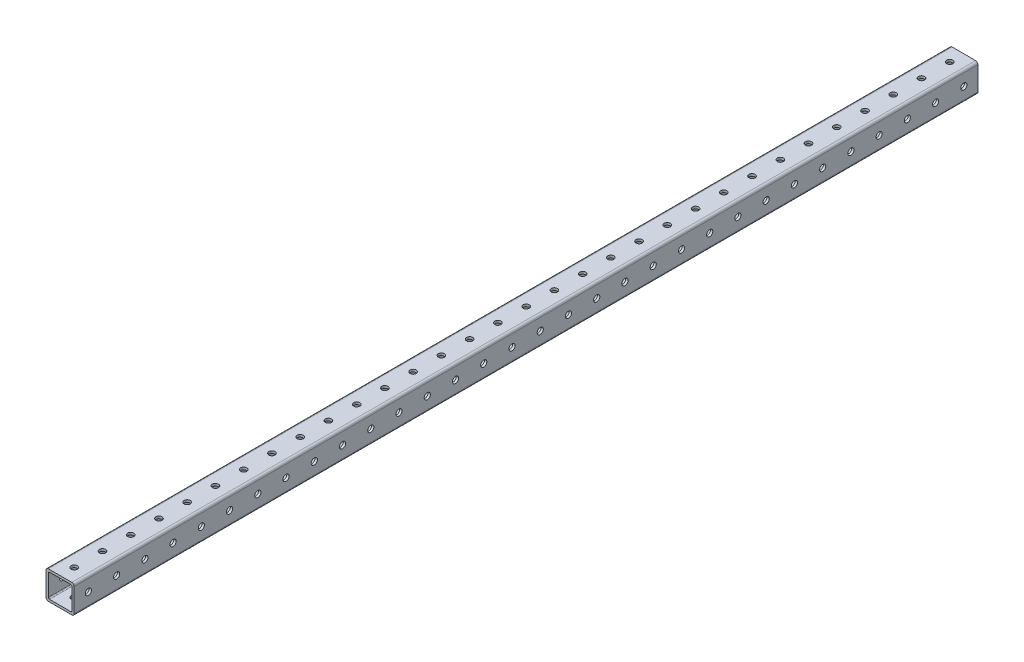
from build123d import *

# Parameters (mm, degrees)
SKETCH1_W                    = 31.75
SKETCH1_H                    = 31.75
EXTRUDE_THIN1_DEPTH          = 609.6
FILLET1_R                    = 1.6002
SKETCH2_R                    = 4.1656
CUT_EXTRUDE1_DEPTH           = 611.195022104
LPATTERN1_COUNT              = 32
LPATTERN1_PITCH              = 38.1
CIRPATTERN1_COPY_1_SKETCH_R  = 4.1656
CIRPATTERN1_COPY_1_DEPTH     = 611.195022104
CIRPATTERN1_COPY_2_SKETCH_R  = 4.1656
CIRPATTERN1_COPY_2_DEPTH     = 611.195022104
CIRPATTERN1_COPY_3_SKETCH_R  = 4.1656
CIRPATTERN1_COPY_3_DEPTH     = 611.195022104
CIRPATTERN1_COPY_4_SKETCH_R  = 4.1656
CIRPATTERN1_COPY_4_DEPTH     = 611.195022104
CIRPATTERN1_COPY_5_SKETCH_R  = 4.1656
CIRPATTERN1_COPY_5_DEPTH     = 611.195022104
CIRPATTERN1_COPY_6_SKETCH_R  = 4.1656
CIRPATTERN1_COPY_6_DEPTH     = 611.195022104
CIRPATTERN1_COPY_7_SKETCH_R  = 4.1656
CIRPATTERN1_COPY_7_DEPTH     = 611.195022104
CIRPATTERN1_COPY_8_SKETCH_R  = 4.1656
CIRPATTERN1_COPY_8_DEPTH     = 611.195022104
CIRPATTERN1_COPY_9_SKETCH_R  = 4.1656
CIRPATTERN1_COPY_9_DEPTH     = 611.195022104
CIRPATTERN1_COPY_10_SKETCH_R = 4.1656
CIRPATTERN1_COPY_10_DEPTH    = 611.195022104
CIRPATTERN1_COPY_11_SKETCH_R = 4.1656
CIRPATTERN1_COPY_11_DEPTH    = 611.195022104
CIRPATTERN1_COPY_12_SKETCH_R = 4.1656
CIRPATTERN1_COPY_12_DEPTH    = 611.195022104
CIRPATTERN1_COPY_13_SKETCH_R = 4.1656
CIRPATTERN1_COPY_13_DEPTH    = 611.195022104
CIRPATTERN1_COPY_14_SKETCH_R = 4.1656
CIRPATTERN1_COPY_14_DEPTH    = 611.195022104
CIRPATTERN1_COPY_15_SKETCH_R = 4.1656
CIRPATTERN1_COPY_15_DEPTH    = 611.195022104
CIRPATTERN1_COPY_16_SKETCH_R = 4.1656
CIRPATTERN1_COPY_16_DEPTH    = 611.195022104
CIRPATTERN1_COPY_17_SKETCH_R = 4.1656
CIRPATTERN1_COPY_17_DEPTH    = 611.195022104
CIRPATTERN1_COPY_18_SKETCH_R = 4.1656
CIRPATTERN1_COPY_18_DEPTH    = 611.195022104
CIRPATTERN1_COPY_19_SKETCH_R = 4.1656
CIRPATTERN1_COPY_19_DEPTH    = 611.195022104
CIRPATTERN1_COPY_20_SKETCH_R = 4.1656
CIRPATTERN1_COPY_20_DEPTH    = 611.195022104
CIRPATTERN1_COPY_21_SKETCH_R = 4.1656
CIRPATTERN1_COPY_21_DEPTH    = 611.195022104
CIRPATTERN1_COPY_22_SKETCH_R = 4.1656
CIRPATTERN1_COPY_22_DEPTH    = 611.195022104
CIRPATTERN1_COPY_23_SKETCH_R = 4.1656
CIRPATTERN1_COPY_23_DEPTH    = 611.195022104
CIRPATTERN1_COPY_24_SKETCH_R = 4.1656
CIRPATTERN1_COPY_24_DEPTH    = 611.195022104
CIRPATTERN1_COPY_25_SKETCH_R = 4.1656
CIRPATTERN1_COPY_25_DEPTH    = 611.195022104
CIRPATTERN1_COPY_26_SKETCH_R = 4.1656
CIRPATTERN1_COPY_26_DEPTH    = 611.195022104
CIRPATTERN1_COPY_27_SKETCH_R = 4.1656
CIRPATTERN1_COPY_27_DEPTH    = 611.195022104
CIRPATTERN1_COPY_28_SKETCH_R = 4.1656
CIRPATTERN1_COPY_28_DEPTH    = 611.195022104
CIRPATTERN1_COPY_29_SKETCH_R = 4.1656
CIRPATTERN1_COPY_29_DEPTH    = 611.195022104
CIRPATTERN1_COPY_30_SKETCH_R = 4.1656
CIRPATTERN1_COPY_30_DEPTH    = 611.195022104
CIRPATTERN1_COPY_31_SKETCH_R = 4.1656
CIRPATTERN1_COPY_31_DEPTH    = 611.195022104
CIRPATTERN1_COPY_32_SKETCH_R = 4.1656
CIRPATTERN1_COPY_32_DEPTH    = 611.195022104


with BuildPart() as part:
    # Sketch1 → Extrude-Thin1 (new, symmetric)
    with BuildSketch(Plane.XY):
        with BuildLine():
            Line((-15.875, 19.05), (15.875, 19.05))
            ThreePointArc((15.875, 19.05), (18.12006403, 18.12006403), (19.05, 15.875))
            Line((19.05, 15.875), (19.05, -15.875))
            ThreePointArc((19.05, -15.875), (18.12006403, -18.12006403), (15.875, -19.05))
            Line((15.875, -19.05), (-15.875, -19.05))
            ThreePointArc((-15.875, -19.05), (-18.12006403, -18.12006403), (-19.05, -15.875))
            Line((-19.05, -15.875), (-19.05, 15.875))
            ThreePointArc((-19.05, 15.875), (-18.12006403, 18.12006403), (-15.875, 19.05))
        make_face()
        Rectangle(SKETCH1_W, SKETCH1_H, mode=Mode.SUBTRACT)
    extrude(amount=EXTRUDE_THIN1_DEPTH, both=True)

    # Fillet1
    fillet1_edges = [part.edges().sort_by_distance(p)[0] for p in [
        (15.875, -15.875, 0),
        (15.875, 15.875, 0),
        (-15.875, 15.875, 0),
        (-15.875, -15.875, 0),
    ]]
    fillet(fillet1_edges, radius=FILLET1_R)

    # Sketch2 → Cut-Extrude1 (cut, symmetric)
    with BuildSketch(Plane(origin=(0, 0, 0), x_dir=(1, 0, 0), z_dir=(0, 1, 0))):
        with Locations((0, -590.55)):
            Circle(SKETCH2_R)
    cut_extrude1 = extrude(amount=CUT_EXTRUDE1_DEPTH, both=True, mode=Mode.SUBTRACT)

    # LPattern1: Cut-Extrude1 ×32
    with Locations(*[(0, 0, -i * LPATTERN1_PITCH) for i in range(1, LPATTERN1_COUNT)]):
        add(cut_extrude1, mode=Mode.SUBTRACT)

    # CirPattern1 copy 1 sketch → CirPattern1 copy 1 (cut, symmetric)
    with BuildSketch(Plane(origin=(0, 0, -38.1), x_dir=(0, -1, 0), z_dir=(1, 0, 0))):
        with Locations((0, -590.55)):
            Circle(CIRPATTERN1_COPY_1_SKETCH_R)
    extrude(amount=CIRPATTERN1_COPY_1_DEPTH, both=True, mode=Mode.SUBTRACT)

    # CirPattern1 copy 2 sketch → CirPattern1 copy 2 (cut, symmetric)
    with BuildSketch(Plane(origin=(0, 0, -76.2), x_dir=(0, -1, 0), z_dir=(1, 0, 0))):
        with Locations((0, -590.55)):
            Circle(CIRPATTERN1_COPY_2_SKETCH_R)
    extrude(amount=CIRPATTERN1_COPY_2_DEPTH, both=True, mode=Mode.SUBTRACT)

    # CirPattern1 copy 3 sketch → CirPattern1 copy 3 (cut, symmetric)
    with BuildSketch(Plane(origin=(0, 0, -114.3), x_dir=(0, -1, 0), z_dir=(1, 0, 0))):
        with Locations((0, -590.55)):
            Circle(CIRPATTERN1_COPY_3_SKETCH_R)
    extrude(amount=CIRPATTERN1_COPY_3_DEPTH, both=True, mode=Mode.SUBTRACT)

    # CirPattern1 copy 4 sketch → CirPattern1 copy 4 (cut, symmetric)
    with BuildSketch(Plane(origin=(0, 0, -152.4), x_dir=(0, -1, 0), z_dir=(1, 0, 0))):
        with Locations((0, -590.55)):
            Circle(CIRPATTERN1_COPY_4_SKETCH_R)
    extrude(amount=CIRPATTERN1_COPY_4_DEPTH, both=True, mode=Mode.SUBTRACT)

    # CirPattern1 copy 5 sketch → CirPattern1 copy 5 (cut, symmetric)
    with BuildSketch(Plane(origin=(0, 0, -190.5), x_dir=(0, -1, 0), z_dir=(1, 0, 0))):
        with Locations((0, -590.55)):
            Circle(CIRPATTERN1_COPY_5_SKETCH_R)
    extrude(amount=CIRPATTERN1_COPY_5_DEPTH, both=True, mode=Mode.SUBTRACT)

    # CirPattern1 copy 6 sketch → CirPattern1 copy 6 (cut, symmetric)
    with BuildSketch(Plane(origin=(0, 0, -228.6), x_dir=(0, -1, 0), z_dir=(1, 0, 0))):
        with Locations((0, -590.55)):
            Circle(CIRPATTERN1_COPY_6_SKETCH_R)
    extrude(amount=CIRPATTERN1_COPY_6_DEPTH, both=True, mode=Mode.SUBTRACT)

    # CirPattern1 copy 7 sketch → CirPattern1 copy 7 (cut, symmetric)
    with BuildSketch(Plane(origin=(0, 0, -266.7), x_dir=(0, -1, 0), z_dir=(1, 0, 0))):
        with Locations((0, -590.55)):
            Circle(CIRPATTERN1_COPY_7_SKETCH_R)
    extrude(amount=CIRPATTERN1_COPY_7_DEPTH, both=True, mode=Mode.SUBTRACT)

    # CirPattern1 copy 8 sketch → CirPattern1 copy 8 (cut, symmetric)
    with BuildSketch(Plane(origin=(0, 0, -304.8), x_dir=(0, -1, 0), z_dir=(1, 0, 0))):
        with Locations((0, -590.55)):
            Circle(CIRPATTERN1_COPY_8_SKETCH_R)
    extrude(amount=CIRPATTERN1_COPY_8_DEPTH, both=True, mode=Mode.SUBTRACT)

    # CirPattern1 copy 9 sketch → CirPattern1 copy 9 (cut, symmetric)
    with BuildSketch(Plane(origin=(0, 0, -342.9), x_dir=(0, -1, 0), z_dir=(1, 0, 0))):
        with Locations((0, -590.55)):
            Circle(CIRPATTERN1_COPY_9_SKETCH_R)
    extrude(amount=CIRPATTERN1_COPY_9_DEPTH, both=True, mode=Mode.SUBTRACT)

    # CirPattern1 copy 10 sketch → CirPattern1 copy 10 (cut, symmetric)
    with BuildSketch(Plane(origin=(0, 0, -381), x_dir=(0, -1, 0), z_dir=(1, 0, 0))):
        with Locations((0, -590.55)):
            Circle(CIRPATTERN1_COPY_10_SKETCH_R)
    extrude(amount=CIRPATTERN1_COPY_10_DEPTH, both=True, mode=Mode.SUBTRACT)

    # CirPattern1 copy 11 sketch → CirPattern1 copy 11 (cut, symmetric)
    with BuildSketch(Plane(origin=(0, 0, -419.1), x_dir=(0, -1, 0), z_dir=(1, 0, 0))):
        with Locations((0, -590.55)):
            Circle(CIRPATTERN1_COPY_11_SKETCH_R)
    extrude(amount=CIRPATTERN1_COPY_11_DEPTH, both=True, mode=Mode.SUBTRACT)

    # CirPattern1 copy 12 sketch → CirPattern1 copy 12 (cut, symmetric)
    with BuildSketch(Plane(origin=(0, 0, -457.2), x_dir=(0, -1, 0), z_dir=(1, 0, 0))):
        with Locations((0, -590.55)):
            Circle(CIRPATTERN1_COPY_12_SKETCH_R)
    extrude(amount=CIRPATTERN1_COPY_12_DEPTH, both=True, mode=Mode.SUBTRACT)

    # CirPattern1 copy 13 sketch → CirPattern1 copy 13 (cut, symmetric)
    with BuildSketch(Plane(origin=(0, 0, -495.3), x_dir=(0, -1, 0), z_dir=(1, 0, 0))):
        with Locations((0, -590.55)):
            Circle(CIRPATTERN1_COPY_13_SKETCH_R)
    extrude(amount=CIRPATTERN1_COPY_13_DEPTH, both=True, mode=Mode.SUBTRACT)

    # CirPattern1 copy 14 sketch → CirPattern1 copy 14 (cut, symmetric)
    with BuildSketch(Plane(origin=(0, 0, -533.4), x_dir=(0, -1, 0), z_dir=(1, 0, 0))):
        with Locations((0, -590.55)):
            Circle(CIRPATTERN1_COPY_14_SKETCH_R)
    extrude(amount=CIRPATTERN1_COPY_14_DEPTH, both=True, mode=Mode.SUBTRACT)

    # CirPattern1 copy 15 sketch → CirPattern1 copy 15 (cut, symmetric)
    with BuildSketch(Plane(origin=(0, 0, -571.5), x_dir=(0, -1, 0), z_dir=(1, 0, 0))):
        with Locations((0, -590.55)):
            Circle(CIRPATTERN1_COPY_15_SKETCH_R)
    extrude(amount=CIRPATTERN1_COPY_15_DEPTH, both=True, mode=Mode.SUBTRACT)

    # CirPattern1 copy 16 sketch → CirPattern1 copy 16 (cut, symmetric)
    with BuildSketch(Plane(origin=(0, 0, -609.6), x_dir=(0, -1, 0), z_dir=(1, 0, 0))):
        with Locations((0, -590.55)):
            Circle(CIRPATTERN1_COPY_16_SKETCH_R)
    extrude(amount=CIRPATTERN1_COPY_16_DEPTH, both=True, mode=Mode.SUBTRACT)

    # CirPattern1 copy 17 sketch → CirPattern1 copy 17 (cut, symmetric)
    with BuildSketch(Plane(origin=(0, 0, -647.7), x_dir=(0, -1, 0), z_dir=(1, 0, 0))):
        with Locations((0, -590.55)):
            Circle(CIRPATTERN1_COPY_17_SKETCH_R)
    extrude(amount=CIRPATTERN1_COPY_17_DEPTH, both=True, mode=Mode.SUBTRACT)

    # CirPattern1 copy 18 sketch → CirPattern1 copy 18 (cut, symmetric)
    with BuildSketch(Plane(origin=(0, 0, -685.8), x_dir=(0, -1, 0), z_dir=(1, 0, 0))):
        with Locations((0, -590.55)):
            Circle(CIRPATTERN1_COPY_18_SKETCH_R)
    extrude(amount=CIRPATTERN1_COPY_18_DEPTH, both=True, mode=Mode.SUBTRACT)

    # CirPattern1 copy 19 sketch → CirPattern1 copy 19 (cut, symmetric)
    with BuildSketch(Plane(origin=(0, 0, -723.9), x_dir=(0, -1, 0), z_dir=(1, 0, 0))):
        with Locations((0, -590.55)):
            Circle(CIRPATTERN1_COPY_19_SKETCH_R)
    extrude(amount=CIRPATTERN1_COPY_19_DEPTH, both=True, mode=Mode.SUBTRACT)

    # CirPattern1 copy 20 sketch → CirPattern1 copy 20 (cut, symmetric)
    with BuildSketch(Plane(origin=(0, 0, -762), x_dir=(0, -1, 0), z_dir=(1, 0, 0))):
        with Locations((0, -590.55)):
            Circle(CIRPATTERN1_COPY_20_SKETCH_R)
    extrude(amount=CIRPATTERN1_COPY_20_DEPTH, both=True, mode=Mode.SUBTRACT)

    # CirPattern1 copy 21 sketch → CirPattern1 copy 21 (cut, symmetric)
    with BuildSketch(Plane(origin=(0, 0, -800.1), x_dir=(0, -1, 0), z_dir=(1, 0, 0))):
        with Locations((0, -590.55)):
            Circle(CIRPATTERN1_COPY_21_SKETCH_R)
    extrude(amount=CIRPATTERN1_COPY_21_DEPTH, both=True, mode=Mode.SUBTRACT)

    # CirPattern1 copy 22 sketch → CirPattern1 copy 22 (cut, symmetric)
    with BuildSketch(Plane(origin=(0, 0, -838.2), x_dir=(0, -1, 0), z_dir=(1, 0, 0))):
        with Locations((0, -590.55)):
            Circle(CIRPATTERN1_COPY_22_SKETCH_R)
    extrude(amount=CIRPATTERN1_COPY_22_DEPTH, both=True, mode=Mode.SUBTRACT)

    # CirPattern1 copy 23 sketch → CirPattern1 copy 23 (cut, symmetric)
    with BuildSketch(Plane(origin=(0, 0, -876.3), x_dir=(0, -1, 0), z_dir=(1, 0, 0))):
        with Locations((0, -590.55)):
            Circle(CIRPATTERN1_COPY_23_SKETCH_R)
    extrude(amount=CIRPATTERN1_COPY_23_DEPTH, both=True, mode=Mode.SUBTRACT)

    # CirPattern1 copy 24 sketch → CirPattern1 copy 24 (cut, symmetric)
    with BuildSketch(Plane(origin=(0, 0, -914.4), x_dir=(0, -1, 0), z_dir=(1, 0, 0))):
        with Locations((0, -590.55)):
            Circle(CIRPATTERN1_COPY_24_SKETCH_R)
    extrude(amount=CIRPATTERN1_COPY_24_DEPTH, both=True, mode=Mode.SUBTRACT)

    # CirPattern1 copy 25 sketch → CirPattern1 copy 25 (cut, symmetric)
    with BuildSketch(Plane(origin=(0, 0, -952.5), x_dir=(0, -1, 0), z_dir=(1, 0, 0))):
        with Locations((0, -590.55)):
            Circle(CIRPATTERN1_COPY_25_SKETCH_R)
    extrude(amount=CIRPATTERN1_COPY_25_DEPTH, both=True, mode=Mode.SUBTRACT)

    # CirPattern1 copy 26 sketch → CirPattern1 copy 26 (cut, symmetric)
    with BuildSketch(Plane(origin=(0, 0, -990.6), x_dir=(0, -1, 0), z_dir=(1, 0, 0))):
        with Locations((0, -590.55)):
            Circle(CIRPATTERN1_COPY_26_SKETCH_R)
    extrude(amount=CIRPATTERN1_COPY_26_DEPTH, both=True, mode=Mode.SUBTRACT)

    # CirPattern1 copy 27 sketch → CirPattern1 copy 27 (cut, symmetric)
    with BuildSketch(Plane(origin=(0, 0, -1028.7), x_dir=(0, -1, 0), z_dir=(1, 0, 0))):
        with Locations((0, -590.55)):
            Circle(CIRPATTERN1_COPY_27_SKETCH_R)
    extrude(amount=CIRPATTERN1_COPY_27_DEPTH, both=True, mode=Mode.SUBTRACT)

    # CirPattern1 copy 28 sketch → CirPattern1 copy 28 (cut, symmetric)
    with BuildSketch(Plane(origin=(0, 0, -1066.8), x_dir=(0, -1, 0), z_dir=(1, 0, 0))):
        with Locations((0, -590.55)):
            Circle(CIRPATTERN1_COPY_28_SKETCH_R)
    extrude(amount=CIRPATTERN1_COPY_28_DEPTH, both=True, mode=Mode.SUBTRACT)

    # CirPattern1 copy 29 sketch → CirPattern1 copy 29 (cut, symmetric)
    with BuildSketch(Plane(origin=(0, 0, -1104.9), x_dir=(0, -1, 0), z_dir=(1, 0, 0))):
        with Locations((0, -590.55)):
            Circle(CIRPATTERN1_COPY_29_SKETCH_R)
    extrude(amount=CIRPATTERN1_COPY_29_DEPTH, both=True, mode=Mode.SUBTRACT)

    # CirPattern1 copy 30 sketch → CirPattern1 copy 30 (cut, symmetric)
    with BuildSketch(Plane(origin=(0, 0, -1143), x_dir=(0, -1, 0), z_dir=(1, 0, 0))):
        with Locations((0, -590.55)):
            Circle(CIRPATTERN1_COPY_30_SKETCH_R)
    extrude(amount=CIRPATTERN1_COPY_30_DEPTH, both=True, mode=Mode.SUBTRACT)

    # CirPattern1 copy 31 sketch → CirPattern1 copy 31 (cut, symmetric)
    with BuildSketch(Plane(origin=(0, 0, -1181.1), x_dir=(0, -1, 0), z_dir=(1, 0, 0))):
        with Locations((0, -590.55)):
            Circle(CIRPATTERN1_COPY_31_SKETCH_R)
    extrude(amount=CIRPATTERN1_COPY_31_DEPTH, both=True, mode=Mode.SUBTRACT)

    # CirPattern1 copy 32 sketch → CirPattern1 copy 32 (cut, symmetric)
    with BuildSketch(Plane(origin=(0, 0, 0), x_dir=(0, -1, 0), z_dir=(1, 0, 0))):
        with Locations((0, -590.55)):
            Circle(CIRPATTERN1_COPY_32_SKETCH_R)
    extrude(amount=CIRPATTERN1_COPY_32_DEPTH, both=True, mode=Mode.SUBTRACT)


solid = part.part
